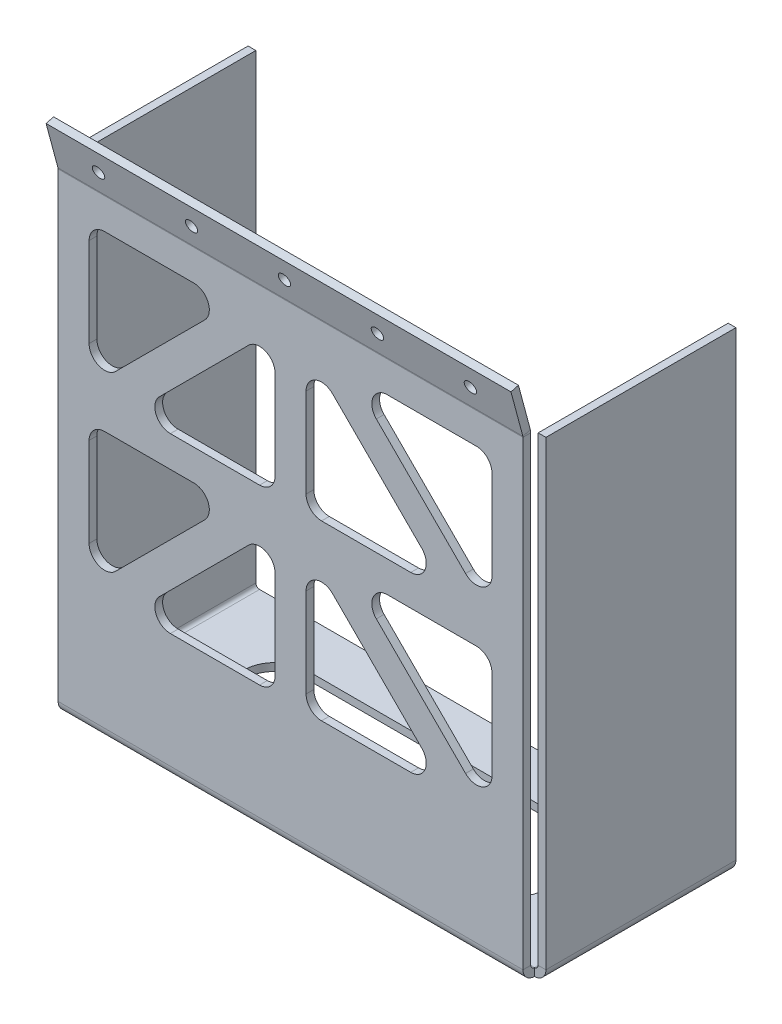
from build123d import *

# Parameters (mm, degrees)
SKETCH1_W                     = 190.5
SKETCH1_H                     = 79.375
BASE_FLANGE1_DEPTH            = 3.175
CUT_EXTRUDE1_DEPTH            = 207.399421632
EDGE_FLANGE1_STRIP_W          = 15.748
EDGE_FLANGE1_STRIP_H          = 3.175
EDGE_FLANGE1_STRIP_CUT_DEPTH  = 190.5
EDGE_FLANGE1_DEPTH            = 190.5
EDGE_FLANGE2_DEPTH            = 77.851
EDGE_FLANGE2_BEND_DEPTH       = 77.851
UNFOLD4_OUTLINE_W             = 4.699
UNFOLD4_OUTLINE_H             = 77.851
UNFOLD4_OUTLINE_W_2           = 190.5
UNFOLD4_OUTLINE_H_2           = 4.699
UNFOLD4_DEPTH                 = 190.5
UNFOLD4_START                 = -3.175
UNFOLD4_2_OUTLINE_W           = 193.863532771
UNFOLD4_2_OUTLINE_H           = 77.851
UNFOLD4_2_OUTLINE_W_2         = 190.5
UNFOLD4_2_OUTLINE_H_2         = 193.863532771
UNFOLD4_2_DEPTH               = 3.175
CUT_EXTRUDE5_DEPTH            = 430.813799006
FOLD1_DEPTH                   = 190.5
FOLD1_START                   = -193.863532771
FOLD1_2_OUTLINE_W             = 3.175
FOLD1_2_OUTLINE_H             = 77.851
FOLD1_2_DEPTH                 = 189.164532771
FOLD1_START_2                 = 195.199
FOLD1_3_OUTLINE_W             = 3.175
FOLD1_3_OUTLINE_H             = 77.851
FOLD1_3_DEPTH                 = 189.164532771
FOLD1_4_DEPTH                 = 190.5
FOLD1_START_3                 = -4.699
FOLD1_5_OUTLINE_W             = 190.5
FOLD1_5_OUTLINE_H             = 77.851
FOLD1_5_DEPTH                 = 4.699
FOLD1_START_4                 = 190.5
FOLD1_6_OUTLINE_W             = 190.5
FOLD1_6_OUTLINE_H             = 77.851
FOLD1_6_DEPTH                 = 4.699
FOLD1_START_5                 = -79.375
FOLD1_7_DEPTH                 = 82.55
EDGE_FLANGE3_DEPTH            = 190.5
F_3_16_0_195_DIAMETER_HOLE1_D = 4.953


with BuildPart() as part:
    # Base-Flange1: sheet metal written as solids
    # Sketch1 → Base-Flange1 (new body)
    with BuildSketch(Plane(origin=(0, 0, 0), x_dir=(1, 0, 0), z_dir=(0, 1, 0))):
        with Locations((95.25, 39.6875)):
            Rectangle(SKETCH1_W, SKETCH1_H)
    extrude(amount=-BASE_FLANGE1_DEPTH)

    # Sketch6 → Cut-Extrude1 (cut, through all)
    with BuildSketch(Plane(origin=(0, 0, 0), x_dir=(1, 0, 0), z_dir=(0, 1, 0))):
        with BuildLine():
            Line((38.1, 60.325), (152.4, 60.325))
            ThreePointArc((152.4, 60.325), (161.380256121, 56.605256121), (165.1, 47.625))
            Line((165.1, 47.625), (165.1, 31.75))
            ThreePointArc((165.1, 31.75), (161.380256121, 22.769743879), (152.4, 19.05))
            Line((152.4, 19.05), (38.1, 19.05))
            ThreePointArc((38.1, 19.05), (29.119743879, 22.769743879), (25.4, 31.75))
            Line((25.4, 31.75), (25.4, 47.625))
            ThreePointArc((25.4, 47.625), (29.119743879, 56.605256121), (38.1, 60.325))
        make_face()
    extrude(amount=-CUT_EXTRUDE1_DEPTH, mode=Mode.SUBTRACT)

    # Edge-Flange1: sheet metal written as solids
    # Edge-Flange1 strip (on a plane across the edge) → Edge-Flange1 strip cut (cut)
    with BuildSketch(Plane(origin=(0, 0, 0), x_dir=(0, 0, -1), z_dir=(1, 0, 0))):
        with Locations((-6.35, -1.5875)):
            Rectangle(EDGE_FLANGE1_STRIP_W, EDGE_FLANGE1_STRIP_H)
    extrude(amount=EDGE_FLANGE1_STRIP_CUT_DEPTH, mode=Mode.SUBTRACT)

    # Edge-Flange1 section (on a plane across the edge) → Edge-Flange1 (add)
    with BuildSketch(Plane(origin=(0, 0, 0), x_dir=(0, 0, -1), z_dir=(1, 0, 0))):
        with BuildLine():
            Line((-3.175, 1.524), (-3.175, 190.5))
            Line((-3.175, 190.5), (0, 190.5))
            Line((0, 190.5), (0, 1.524))
            ThreePointArc((0, 1.524), (0.446369265, 0.446369265), (1.524, 0))
            Line((1.524, 0), (1.524, -3.175))
            ThreePointArc((1.524, -3.175), (-1.798694765, -1.798694765), (-3.175, 1.524))
        make_face()
    extrude(amount=EDGE_FLANGE1_DEPTH)

    # Edge-Flange2: sheet metal written as solids
    # Edge-Flange2 section (on a plane across the edge) → Edge-Flange2 (add)
    with BuildSketch(Plane(origin=(-1.524, 0, -79.375), x_dir=(1, 0, 0), z_dir=(0, 0, 1))):
        with BuildLine():
            Line((-3.175, 1.524), (-3.175, 190.5))
            Line((-3.175, 190.5), (0, 190.5))
            Line((0, 190.5), (0, 1.524))
            ThreePointArc((0, 1.524), (0.446369265, 0.446369265), (1.524, 0))
            Line((1.524, 0), (1.524, -3.175))
            ThreePointArc((1.524, -3.175), (-1.798694765, -1.798694765), (-3.175, 1.524))
        make_face()
    extrude(amount=EDGE_FLANGE2_DEPTH)

    # Edge-Flange2 section 2 (on a plane across the edge) → Edge-Flange2 bend (add)
    with BuildSketch(Plane(origin=(192.024, 0, -1.524), x_dir=(-1, 0, 0), z_dir=(0, 0, -1))):
        with BuildLine():
            Line((-3.175, 1.524), (-3.175, 190.5))
            Line((-3.175, 190.5), (0, 190.5))
            Line((0, 190.5), (0, 1.524))
            ThreePointArc((0, 1.524), (0.446369265, 0.446369265), (1.524, 0))
            Line((1.524, 0), (1.524, -3.175))
            ThreePointArc((1.524, -3.175), (-1.798694765, -1.798694765), (-3.175, 1.524))
        make_face()
    extrude(amount=EDGE_FLANGE2_BEND_DEPTH)

    # Unfold4: read off the stored shape, not the designer's step
    # Unfold4 outline → Unfold4 (cut)
    with BuildSketch(Plane(origin=(0, 0, 0), x_dir=(1, 0, 0), z_dir=(0, 1, 0))):
        with Locations((-2.3495, 40.4495)):
            Rectangle(UNFOLD4_OUTLINE_W, UNFOLD4_OUTLINE_H)
        with Locations((95.25, -0.8255)):
            Rectangle(UNFOLD4_OUTLINE_W_2, UNFOLD4_OUTLINE_H_2)
        with Locations((192.8495, 40.4495)):
            Rectangle(UNFOLD4_OUTLINE_W, UNFOLD4_OUTLINE_H)
    extrude(amount=UNFOLD4_DEPTH, mode=Mode.SUBTRACT)

    # Unfold4 2 outline → Unfold4 2 (add)
    with BuildSketch(Plane(origin=(0, 0, 0), x_dir=(1, 0, 0), z_dir=(0, 1, 0)).offset(UNFOLD4_START)):
        with Locations((287.431766385, 40.4495)):
            Rectangle(UNFOLD4_2_OUTLINE_W, UNFOLD4_2_OUTLINE_H)
        with Locations((-96.931766386, 40.4495)):
            Rectangle(UNFOLD4_2_OUTLINE_W, UNFOLD4_2_OUTLINE_H)
        with Locations((95.25, -95.407766386)):
            Rectangle(UNFOLD4_2_OUTLINE_W_2, UNFOLD4_2_OUTLINE_H_2)
    extrude(amount=UNFOLD4_2_DEPTH)

    # Sketch26 → Cut-Extrude5 (cut, through all)
    with BuildSketch(Plane(origin=(0, 0, 0), x_dir=(1, 0, 0), z_dir=(0, 1, 0))):
        with BuildLine():
            Line((177.8, -102.350045013), (177.8, -65.790813376))
            ThreePointArc((177.8, -65.790813376), (173.880039796, -59.924178345), (166.959871939, -61.300685316))
            Line((166.959871939, -61.300685316), (130.400640303, -97.859916952))
            ThreePointArc((130.400640303, -97.859916952), (129.024133332, -104.780084808), (134.890768363, -108.700045013))
            Line((134.890768363, -108.700045013), (171.45, -108.700045013))
            ThreePointArc((171.45, -108.700045013), (175.940128061, -106.840173073), (177.8, -102.350045013))
        make_face()
        with BuildLine():
            Line((148.999359697, -61.300685316), (112.440128061, -97.859916952))
            ThreePointArc((112.440128061, -97.859916952), (105.519960204, -99.236423923), (101.6, -93.369788892))
            Line((101.6, -93.369788892), (101.6, -56.810557255))
            ThreePointArc((101.6, -56.810557255), (103.459871939, -52.320429195), (107.95, -50.460557255))
            Line((107.95, -50.460557255), (144.509231637, -50.460557255))
            ThreePointArc((144.509231637, -50.460557255), (150.375866668, -54.38051746), (148.999359697, -61.300685316))
        make_face()
        with BuildLine():
            Line((88.9, -56.810557255), (88.9, -93.369788892))
            ThreePointArc((88.9, -93.369788892), (84.980039796, -99.236423923), (78.059871939, -97.859916952))
            Line((78.059871939, -97.859916952), (41.500640303, -61.300685316))
            ThreePointArc((41.500640303, -61.300685316), (40.124133332, -54.38051746), (45.990768363, -50.460557255))
            Line((45.990768363, -50.460557255), (82.55, -50.460557255))
            ThreePointArc((82.55, -50.460557255), (87.040128061, -52.320429195), (88.9, -56.810557255))
        make_face()
        with BuildLine():
            Line((55.609231637, -108.700045013), (19.05, -108.700045013))
            ThreePointArc((19.05, -108.700045013), (14.559871939, -106.840173073), (12.7, -102.350045013))
            Line((12.7, -102.350045013), (12.7, -65.790813376))
            ThreePointArc((12.7, -65.790813376), (16.619960204, -59.924178345), (23.540128061, -61.300685316))
            Line((23.540128061, -61.300685316), (60.099359697, -97.859916952))
            ThreePointArc((60.099359697, -97.859916952), (61.475866668, -104.780084808), (55.609231637, -108.700045013))
        make_face()
        with BuildLine():
            Line((177.8, -173.289532771), (177.8, -136.730301134))
            ThreePointArc((177.8, -136.730301134), (173.880039796, -130.863666103), (166.959871939, -132.240173073))
            Line((166.959871939, -132.240173073), (130.400640303, -168.79940471))
            ThreePointArc((130.400640303, -168.79940471), (129.024133332, -175.719572566), (134.890768363, -179.639532771))
            Line((134.890768363, -179.639532771), (171.45, -179.639532771))
            ThreePointArc((171.45, -179.639532771), (175.940128061, -177.779660831), (177.8, -173.289532771))
        make_face()
        with BuildLine():
            Line((148.999359697, -132.240173073), (112.440128061, -168.79940471))
            ThreePointArc((112.440128061, -168.79940471), (105.519960204, -170.175911681), (101.6, -164.30927665))
            Line((101.6, -164.30927665), (101.6, -127.750045013))
            ThreePointArc((101.6, -127.750045013), (103.459871939, -123.259916952), (107.95, -121.400045013))
            Line((107.95, -121.400045013), (144.509231637, -121.400045013))
            ThreePointArc((144.509231637, -121.400045013), (150.375866668, -125.320005217), (148.999359697, -132.240173073))
        make_face()
        with BuildLine():
            Line((88.9, -127.750045013), (88.9, -164.30927665))
            ThreePointArc((88.9, -164.30927665), (84.980039796, -170.175911681), (78.059871939, -168.79940471))
            Line((78.059871939, -168.79940471), (41.500640303, -132.240173073))
            ThreePointArc((41.500640303, -132.240173073), (40.124133332, -125.320005217), (45.990768363, -121.400045013))
            Line((45.990768363, -121.400045013), (82.55, -121.400045013))
            ThreePointArc((82.55, -121.400045013), (87.040128061, -123.259916952), (88.9, -127.750045013))
        make_face()
        with BuildLine():
            Line((55.609231637, -179.639532771), (19.05, -179.639532771))
            ThreePointArc((19.05, -179.639532771), (14.559871939, -177.779660831), (12.7, -173.289532771))
            Line((12.7, -173.289532771), (12.7, -136.730301134))
            ThreePointArc((12.7, -136.730301134), (16.619960204, -130.863666103), (23.540128061, -132.240173073))
            Line((23.540128061, -132.240173073), (60.099359697, -168.79940471))
            ThreePointArc((60.099359697, -168.79940471), (61.475866668, -175.719572566), (55.609231637, -179.639532771))
        make_face()
    extrude(amount=-CUT_EXTRUDE5_DEPTH, mode=Mode.SUBTRACT)

    # Fold1: read off the stored shape, not the designer's step
    # Fold1 outline → Fold1 (cut)
    with BuildSketch(Plane.YZ):
        with BuildLine():
            ThreePointArc((-3.175, -1.524), (-2.299733581, 1.207238272), (0, 2.921))
            Line((0, 2.921), (0, 192.339532771))
            Line((0, 192.339532771), (-3.175, 192.339532771))
            Line((-3.175, 192.339532771), (-3.175, -1.524))
        make_face()
    extrude(amount=FOLD1_DEPTH, mode=Mode.SUBTRACT)

    # Fold1 2 outline → Fold1 2 (cut)
    with BuildSketch(Plane.YZ.offset(FOLD1_START)):
        with Locations((-1.5875, -40.4495)):
            Rectangle(FOLD1_2_OUTLINE_W, FOLD1_2_OUTLINE_H)
    extrude(amount=FOLD1_2_DEPTH, mode=Mode.SUBTRACT)

    # Fold1 3 outline → Fold1 3 (cut)
    with BuildSketch(Plane.YZ.offset(FOLD1_START_2)):
        with Locations((-1.5875, -40.4495)):
            Rectangle(FOLD1_3_OUTLINE_W, FOLD1_3_OUTLINE_H)
    extrude(amount=FOLD1_3_DEPTH, mode=Mode.SUBTRACT)

    # Fold1 4 outline → Fold1 4 (add)
    with BuildSketch(Plane.YZ):
        with BuildLine():
            Line((0, 2.921), (0, -1.524))
            ThreePointArc((0, -1.524), (0.446369265, -0.446369265), (1.524, 0))
            Line((1.524, 0), (190.5, 0))
            Line((190.5, 0), (190.5, 3.175))
            Line((190.5, 3.175), (1.524, 3.175))
            ThreePointArc((1.524, 3.175), (0.751489159, 3.111065048), (0, 2.921))
        make_face()
    extrude(amount=FOLD1_4_DEPTH)

    # Fold1 5 outline → Fold1 5 (add)
    with BuildSketch(Plane.YZ.offset(FOLD1_START_3)):
        with Locations((95.25, -40.4495)):
            Rectangle(FOLD1_5_OUTLINE_W, FOLD1_5_OUTLINE_H)
    extrude(amount=FOLD1_5_DEPTH)

    # Fold1 6 outline → Fold1 6 (add)
    with BuildSketch(Plane.YZ.offset(FOLD1_START_4)):
        with Locations((95.25, -40.4495)):
            Rectangle(FOLD1_6_OUTLINE_W, FOLD1_6_OUTLINE_H)
    extrude(amount=FOLD1_6_DEPTH)

    # Fold1 7 outline → Fold1 7 (cut)
    with BuildSketch(Plane.XY.offset(FOLD1_START_5)):
        with BuildLine():
            ThreePointArc((195.199, 1.524), (193.822694765, -1.798694765), (190.5, -3.175))
            Line((190.5, -3.175), (195.199, -3.175))
            Line((195.199, -3.175), (195.199, 1.524))
        make_face()
        with BuildLine():
            Line((-4.699, -3.175), (0, -3.175))
            ThreePointArc((0, -3.175), (-3.322694765, -1.798694765), (-4.699, 1.524))
            Line((-4.699, 1.524), (-4.699, -3.175))
        make_face()
        with BuildLine():
            Line((192.024, 1.524), (192.024, 190.5))
            Line((192.024, 190.5), (190.5, 190.5))
            Line((190.5, 190.5), (190.5, 0))
            ThreePointArc((190.5, 0), (191.577630735, 0.446369265), (192.024, 1.524))
        make_face()
        with BuildLine():
            Line((0, 190.5), (-1.524, 190.5))
            Line((-1.524, 190.5), (-1.524, 1.524))
            ThreePointArc((-1.524, 1.524), (-1.077630735, 0.446369265), (0, 0))
            Line((0, 0), (0, 190.5))
        make_face()
        with BuildLine():
            ThreePointArc((12.7, 63.951280605), (16.619960205, 58.084645574), (23.540128061, 59.461152545))
            Line((23.540128061, 59.461152545), (60.099359697, 96.020384182))
            ThreePointArc((60.099359697, 96.020384182), (61.475866668, 102.940552038), (55.609231637, 106.860512242))
            Line((55.609231637, 106.860512242), (19.05, 106.860512242))
            ThreePointArc((19.05, 106.860512242), (14.559871939, 105.000640303), (12.7, 100.510512242))
            Line((12.7, 100.510512242), (12.7, 63.951280605))
        make_face()
        with BuildLine():
            ThreePointArc((177.8, 100.510512242), (175.940128061, 105.000640303), (171.45, 106.860512242))
            Line((171.45, 106.860512242), (134.890768363, 106.860512242))
            ThreePointArc((134.890768363, 106.860512242), (129.024133332, 102.940552038), (130.400640303, 96.020384182))
            Line((130.400640303, 96.020384182), (166.959871939, 59.461152545))
            ThreePointArc((166.959871939, 59.461152545), (173.880039795, 58.084645574), (177.8, 63.951280605))
            Line((177.8, 63.951280605), (177.8, 100.510512242))
        make_face()
        with BuildLine():
            ThreePointArc((19.05, 177.8), (14.559871939, 175.940128061), (12.7, 171.45))
            Line((12.7, 171.45), (12.7, 134.890768363))
            ThreePointArc((12.7, 134.890768363), (16.619960205, 129.024133332), (23.540128061, 130.400640303))
            Line((23.540128061, 130.400640303), (60.099359697, 166.959871939))
            ThreePointArc((60.099359697, 166.959871939), (61.475866668, 173.880039795), (55.609231637, 177.8))
            Line((55.609231637, 177.8), (19.05, 177.8))
        make_face()
        with BuildLine():
            ThreePointArc((82.55, 119.560512242), (87.04012806, 121.420384181), (88.9, 125.910512242))
            Line((88.9, 125.910512242), (88.9, 162.469743879))
            ThreePointArc((88.9, 162.469743879), (84.980039795, 168.33637891), (78.059871939, 166.959871939))
            Line((78.059871939, 166.959871939), (41.500640303, 130.400640303))
            ThreePointArc((41.500640303, 130.400640303), (40.124133332, 123.480472447), (45.990768363, 119.560512242))
            Line((45.990768363, 119.560512242), (82.55, 119.560512242))
        make_face()
        with BuildLine():
            ThreePointArc((82.55, 48.621024484), (87.04012806, 50.480896423), (88.9, 54.971024484))
            Line((88.9, 54.971024484), (88.9, 91.530256121))
            ThreePointArc((88.9, 91.530256121), (84.980039796, 97.396891153), (78.059871939, 96.020384182))
            Line((78.059871939, 96.020384182), (41.500640303, 59.461152545))
            ThreePointArc((41.500640303, 59.461152545), (40.124133332, 52.540984689), (45.990768363, 48.621024484))
            Line((45.990768363, 48.621024484), (82.55, 48.621024484))
        make_face()
        with BuildLine():
            ThreePointArc((101.6, 125.910512242), (103.45987194, 121.420384181), (107.95, 119.560512242))
            Line((107.95, 119.560512242), (144.509231637, 119.560512242))
            ThreePointArc((144.509231637, 119.560512242), (150.375866668, 123.480472447), (148.999359697, 130.400640303))
            Line((148.999359697, 130.400640303), (112.440128061, 166.959871939))
            ThreePointArc((112.440128061, 166.959871939), (105.519960205, 168.33637891), (101.6, 162.469743879))
            Line((101.6, 162.469743879), (101.6, 125.910512242))
        make_face()
        with BuildLine():
            ThreePointArc((112.440128061, 96.020384182), (105.519960204, 97.396891153), (101.6, 91.530256121))
            Line((101.6, 91.530256121), (101.6, 54.971024484))
            ThreePointArc((101.6, 54.971024484), (103.459871939, 50.480896423), (107.95, 48.621024484))
            Line((107.95, 48.621024484), (144.509231637, 48.621024484))
            ThreePointArc((144.509231637, 48.621024484), (150.375866668, 52.540984689), (148.999359697, 59.461152545))
            Line((148.999359697, 59.461152545), (112.440128061, 96.020384182))
        make_face()
        with BuildLine():
            ThreePointArc((166.959871939, 130.400640303), (173.880039795, 129.024133332), (177.8, 134.890768363))
            Line((177.8, 134.890768363), (177.8, 171.45))
            ThreePointArc((177.8, 171.45), (175.940128061, 175.940128061), (171.45, 177.8))
            Line((171.45, 177.8), (134.890768363, 177.8))
            ThreePointArc((134.890768363, 177.8), (129.024133332, 173.880039795), (130.400640303, 166.959871939))
            Line((130.400640303, 166.959871939), (166.959871939, 130.400640303))
        make_face()
    extrude(amount=FOLD1_7_DEPTH, mode=Mode.SUBTRACT)

    # Edge-Flange3: sheet metal written as solids
    # Edge-Flange3 section (on a plane across the edge) → Edge-Flange3 (add)
    with BuildSketch(Plane(origin=(190.5, 190.700638406, 3.175), x_dir=(0, -0.2588190451025154, 0.9659258262890698), z_dir=(-1, 0, 0))):
        with BuildLine():
            Line((-3.175, 0.200638406), (-3.175, 19.05))
            Line((-3.175, 19.05), (0, 19.05))
            Line((0, 19.05), (0, 0.200638406))
            ThreePointArc((0, 0.200638406), (0.013038031, 0.001716489), (0.051929041, -0.193801818))
            Line((0.051929041, -0.193801818), (-3.014885458, -1.015552287))
            ThreePointArc((-3.014885458, -1.015552287), (-3.134799404, -0.412704171), (-3.175, 0.200638406))
        make_face()
    extrude(amount=EDGE_FLANGE3_DEPTH)

    # 3/16 (0.195) Diameter Hole1 (through all)
    with Locations(Plane(origin=(0, 12.802520982, -47.779658772), x_dir=(-1, 0, 0), z_dir=(0, 0.2588190451025156, -0.9659258262890698))):
        with Locations((-19.05, 194.649741398), (-171.45, 194.649741398), (-133.35, 194.649741398), (-95.25, 194.649741398), (-57.15, 194.649741398)):
            Hole(F_3_16_0_195_DIAMETER_HOLE1_D / 2)


solid = part.part
